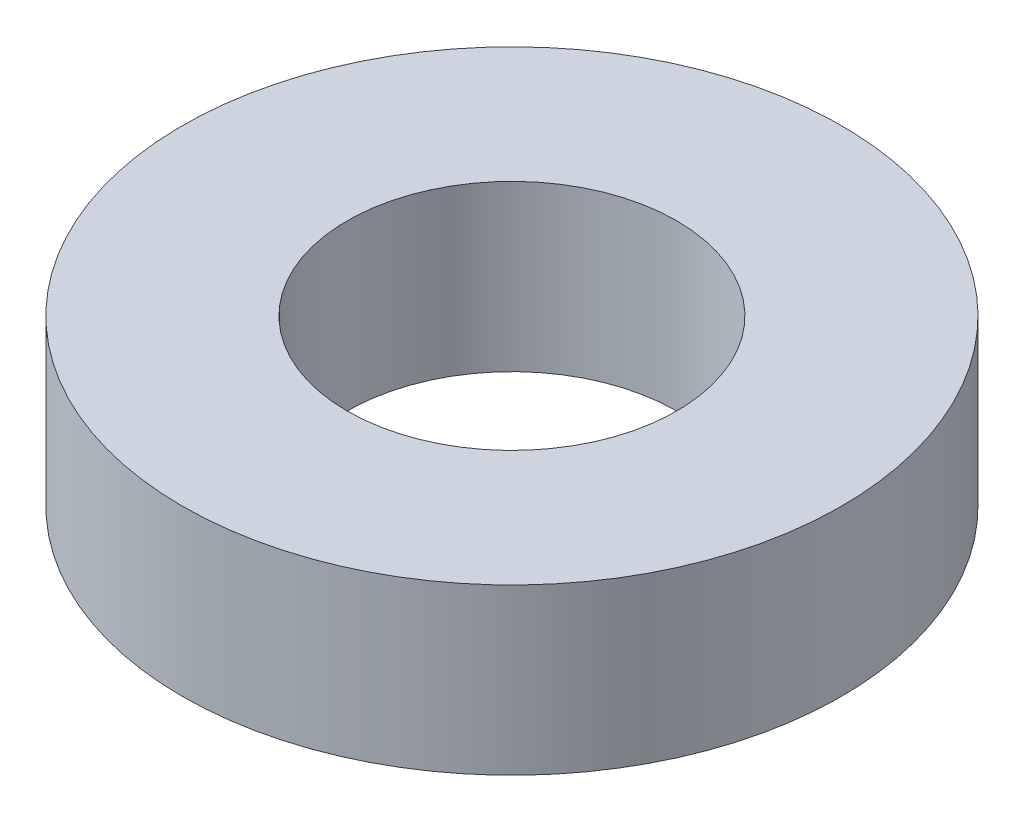
from build123d import *

# Parameters (mm, degrees)
SKETCH2_R           = 2
SKETCH2_R_2         = 1
BOSS_EXTRUDE1_DEPTH = 1


with BuildPart() as part:
    # Sketch2 → Boss-Extrude1 (new body)
    with BuildSketch(Plane(origin=(0, 0, 0), x_dir=(1, 0, 0), z_dir=(0, 1, 0))):
        Circle(SKETCH2_R)
        Circle(SKETCH2_R_2, mode=Mode.SUBTRACT)
    extrude(amount=BOSS_EXTRUDE1_DEPTH)


solid = part.part
